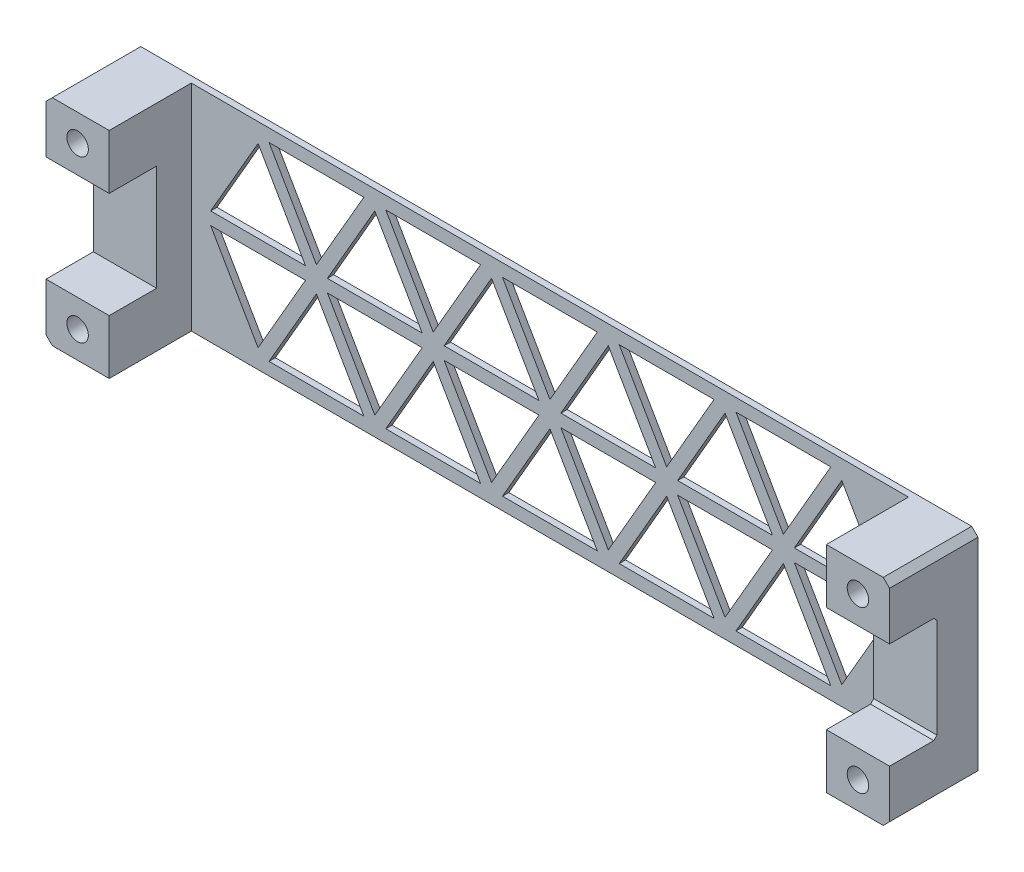
from build123d import *

# Parameters (mm, degrees)
SKETCH1_W                      = 133.5
SKETCH1_H                      = 34
BOSS_EXTRUDE1_DEPTH            = 1
SKETCH2_W                      = 10
SKETCH2_H                      = 8.625
BOSS_EXTRUDE2_DEPTH            = 15
SKETCH2_3_W                    = 10
SKETCH2_3_H                    = 16.75
BOSS_EXTRUDE3_DEPTH            = 6.5
CBORE_FOR_M3_SHCS1_D           = 3.4
CBORE_FOR_M3_SHCS1_CBORE_D     = 6.5
CBORE_FOR_M3_SHCS1_CBORE_DEPTH = 3
CHAMFER1_SIZE                  = 0.5
CHAMFER2_SIZE                  = 0.5
CUT_EXTRUDE1_DEPTH             = 71.495123945
LPATTERN1_COUNT                = 3
LPATTERN1_PITCH                = 18.475
MIRROR2_COPY_1_DEPTH           = 71.495123945
MIRROR2_COPY_2_DEPTH           = 71.495123945
MIRROR2_COPY_3_DEPTH           = 71.495123945
CHAMFER3_SIZE                  = 1
INTERSECT1_START               = 14
INTERSECT1_OUTLINE_R           = 1.7
INTERSECT1_DEPTH               = 1


# Read off the part's stored shape, not the designer's step: Intersect1
with BuildPart() as part:
    # Sketch1 → Boss-Extrude1 (new body)
    with BuildSketch(Plane.XY):
        Rectangle(SKETCH1_W, SKETCH1_H)
    extrude(amount=BOSS_EXTRUDE1_DEPTH)

    # Sketch2 → Boss-Extrude2 (add)
    with BuildSketch(Plane.XY):
        with Locations((61.75, -12.6875)):
            Rectangle(SKETCH2_W, SKETCH2_H)
        with Locations((61.75, 12.6875)):
            Rectangle(SKETCH2_W, SKETCH2_H)
    boss_extrude2 = extrude(amount=BOSS_EXTRUDE2_DEPTH)

    # Sketch2<3> → Boss-Extrude3 (add)
    with BuildSketch(Plane.XY):
        with Locations((61.75, 0)):
            Rectangle(SKETCH2_3_W, SKETCH2_3_H)
    boss_extrude3 = extrude(amount=BOSS_EXTRUDE3_DEPTH)

    # CBORE for M3 SHCS1 (through all)
    with Locations(Plane(origin=(0, 0, 0), x_dir=(-1, 0, 0), z_dir=(0, 0, -1))):
        with Locations((-61.75, 12.75), (-61.75, -12.75)):
            cbore_for_m3_shcs1 = CounterBoreHole(CBORE_FOR_M3_SHCS1_D / 2, CBORE_FOR_M3_SHCS1_CBORE_D / 2, CBORE_FOR_M3_SHCS1_CBORE_DEPTH)

    # Chamfer1
    chamfer1_edges = [part.edges().sort_by_distance(p)[0] for p in [
        (61.75, 8.375, 6.5),
        (61.75, -8.375, 6.5),
    ]]
    chamfer(chamfer1_edges, length=CHAMFER1_SIZE)

    # Mirror1: Boss-Extrude2, Boss-Extrude3, CBORE for M3 SHCS1 across plane
    add(boss_extrude2.mirror(Plane(origin=(0, 0, 0), x_dir=(0, 0, 1), z_dir=(1, 0, 0))))
    add(boss_extrude3.mirror(Plane(origin=(0, 0, 0), x_dir=(0, 0, 1), z_dir=(1, 0, 0))))
    add(cbore_for_m3_shcs1.mirror(Plane(origin=(0, 0, 0), x_dir=(0, 0, 1), z_dir=(1, 0, 0))), mode=Mode.SUBTRACT)

    # Chamfer2
    chamfer2_edges = [part.edges().sort_by_distance(p)[0] for p in [
        (-65, -12.75, 0),
        (-65, 12.75, 0),
        (65, -12.75, 0),
        (65, 12.75, 0),
    ]]
    chamfer(chamfer2_edges, length=CHAMFER2_SIZE)

    # Sketch6 → Cut-Extrude1 (cut, through all)
    with BuildSketch(Plane.XY):
        Polygon((-7.505553499, 15), (0, 2), (7.505553499, 15), align=None)
        Polygon((-16.743157806, 1), (-1.732050808, 1), (-9.237604307, 14), align=None)
        Polygon((-16.743157806, -1), (-9.237604307, -14), (-1.732050808, -1), align=None)
        Polygon((1.732050808, 1), (16.743157806, 1), (9.237604307, 14), align=None)
        Polygon((1.732050808, -1), (9.237604307, -14), (16.743157806, -1), align=None)
        Polygon((-7.505553499, -15), (7.505553499, -15), (0, -2), align=None)
    cut_extrude1 = extrude(amount=CUT_EXTRUDE1_DEPTH, mode=Mode.SUBTRACT)

    # LPattern1: Cut-Extrude1 ×3
    with Locations(*[(-i * LPATTERN1_PITCH, 0, 0) for i in range(1, LPATTERN1_COUNT)]):
        add(cut_extrude1, mode=Mode.SUBTRACT)

    # Mirror2 copy 1 sketch → Mirror2 copy 1 (cut, through all)
    with BuildSketch(Plane(origin=(18.475, 0, 0), x_dir=(-1, 0, 0), z_dir=(0, 0, 1))):
        Polygon((-7.505553499, -15), (0, -2), (7.505553499, -15), align=None)
        Polygon((-16.743157806, -1), (-1.732050808, -1), (-9.237604307, -14), align=None)
        Polygon((-16.743157806, 1), (-9.237604307, 14), (-1.732050808, 1), align=None)
        Polygon((1.732050808, -1), (16.743157806, -1), (9.237604307, -14), align=None)
        Polygon((1.732050808, 1), (9.237604307, 14), (16.743157806, 1), align=None)
        Polygon((-7.505553499, 15), (7.505553499, 15), (0, 2), align=None)
    extrude(amount=MIRROR2_COPY_1_DEPTH, mode=Mode.SUBTRACT)

    # Mirror2 copy 2 sketch → Mirror2 copy 2 (cut, through all)
    with BuildSketch(Plane(origin=(36.95, 0, 0), x_dir=(-1, 0, 0), z_dir=(0, 0, 1))):
        Polygon((-7.505553499, -15), (0, -2), (7.505553499, -15), align=None)
        Polygon((-16.743157806, -1), (-1.732050808, -1), (-9.237604307, -14), align=None)
        Polygon((-16.743157806, 1), (-9.237604307, 14), (-1.732050808, 1), align=None)
        Polygon((1.732050808, -1), (16.743157806, -1), (9.237604307, -14), align=None)
        Polygon((1.732050808, 1), (9.237604307, 14), (16.743157806, 1), align=None)
        Polygon((-7.505553499, 15), (7.505553499, 15), (0, 2), align=None)
    extrude(amount=MIRROR2_COPY_2_DEPTH, mode=Mode.SUBTRACT)

    # Mirror2 copy 3 sketch → Mirror2 copy 3 (cut, through all)
    with BuildSketch(Plane(origin=(0, 0, 0), x_dir=(-1, 0, 0), z_dir=(0, 0, 1))):
        Polygon((-7.505553499, -15), (0, -2), (7.505553499, -15), align=None)
        Polygon((-16.743157806, -1), (-1.732050808, -1), (-9.237604307, -14), align=None)
        Polygon((-16.743157806, 1), (-9.237604307, 14), (-1.732050808, 1), align=None)
        Polygon((1.732050808, -1), (16.743157806, -1), (9.237604307, -14), align=None)
        Polygon((1.732050808, 1), (9.237604307, 14), (16.743157806, 1), align=None)
        Polygon((-7.505553499, 15), (7.505553499, 15), (0, 2), align=None)
    extrude(amount=MIRROR2_COPY_3_DEPTH, mode=Mode.SUBTRACT)

    # Chamfer3
    chamfer3_edges = [part.edges().sort_by_distance(p)[0] for p in [
        (66.75, -17, 7.5),
        (-66.75, -17, 7.5),
        (-66.75, 17, 7.5),
        (66.75, 17, 7.5),
    ]]
    chamfer(chamfer3_edges, length=CHAMFER3_SIZE)

    # Intersect1 outline → Intersect1 (cut)
    # profile 1 of 4: a face of its own
    with BuildSketch(Plane.XY.offset(INTERSECT1_START)):
        Polygon((-56.75, 17), (-65.75, 17), (-66.75, 16), (-66.75, 8.375), (-56.75, 8.375), align=None)
        with Locations((-61.75, 12.75)):
            Circle(INTERSECT1_OUTLINE_R, mode=Mode.SUBTRACT)
    # profile 2 of 4: a face of its own
    with BuildSketch(Plane.XY.offset(INTERSECT1_START)):
        Polygon((65.75, 17), (56.75, 17), (56.75, 8.375), (66.75, 8.375), (66.75, 16), align=None)
        with Locations((61.75, 12.75)):
            Circle(INTERSECT1_OUTLINE_R, mode=Mode.SUBTRACT)
    # profile 3 of 4: a face of its own
    with BuildSketch(Plane.XY.offset(INTERSECT1_START)):
        Polygon((-56.75, -17), (-56.75, -8.375), (-66.75, -8.375), (-66.75, -16), (-65.75, -17), align=None)
        with Locations((-61.75, -12.75)):
            Circle(INTERSECT1_OUTLINE_R, mode=Mode.SUBTRACT)
    # profile 4 of 4: a face of its own
    with BuildSketch(Plane.XY.offset(INTERSECT1_START)):
        Polygon((66.75, -8.375), (56.75, -8.375), (56.75, -17), (65.75, -17), (66.75, -16), align=None)
        with Locations((61.75, -12.75)):
            Circle(INTERSECT1_OUTLINE_R, mode=Mode.SUBTRACT)
    extrude(amount=INTERSECT1_DEPTH, mode=Mode.SUBTRACT)


solid = part.part
